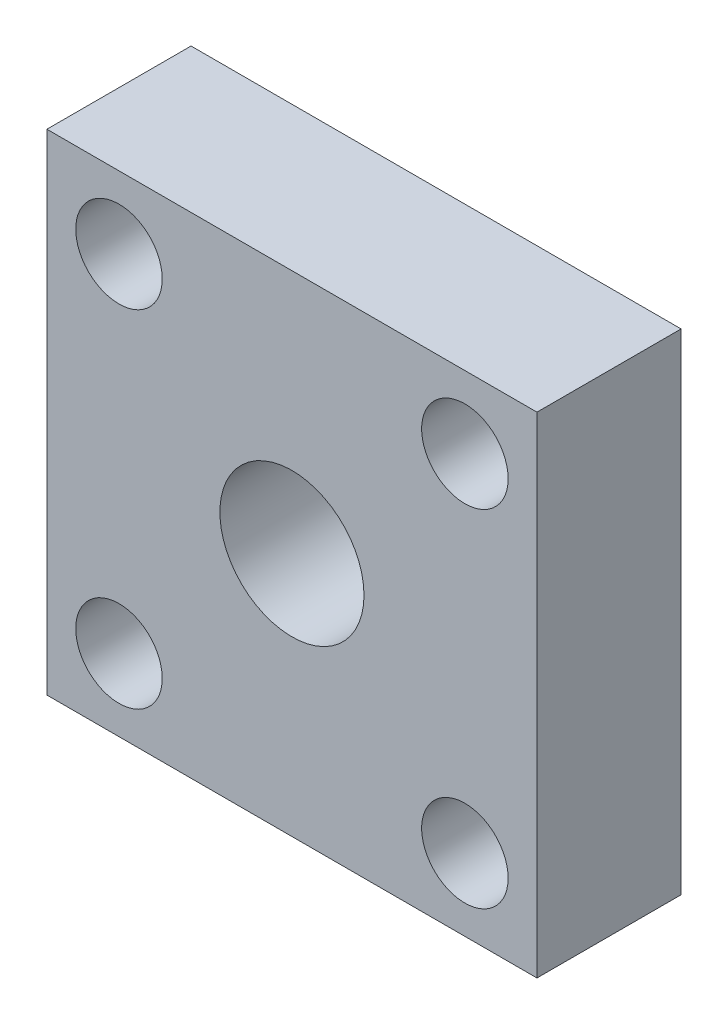
from build123d import *

# Parameters (mm, degrees)
SKETCH1_W            = 34
SKETCH1_H            = 34
SKETCH1_R            = 5
BOSS_EXTRUDE1_DEPTH  = 10
SKETCH2_R            = 3
CUT_EXTRUDE1_DEPTH   = 5
LPATTERN1_COUNT      = 2
LPATTERN1_PITCH      = 24
LPATTERN1_COUNT_DIR2 = 2
LPATTERN1_PITCH_DIR2 = 24


with BuildPart() as part:
    # Sketch1 → Boss-Extrude1 (new body)
    with BuildSketch(Plane.XY):
        with Locations((-1.444444444, -4.888888889)):
            Rectangle(SKETCH1_W, SKETCH1_H)
        with Locations((-1.444444444, -4.888888889)):
            Circle(SKETCH1_R, mode=Mode.SUBTRACT)
    extrude(amount=BOSS_EXTRUDE1_DEPTH)

    # Sketch2 → Cut-Extrude1 (cut)
    with BuildSketch(Plane.XY.offset(10)):
        with Locations((-13.444444444, 7.111111111)):
            Circle(SKETCH2_R)
    cut_extrude1 = extrude(amount=-CUT_EXTRUDE1_DEPTH, mode=Mode.SUBTRACT)

    # LPattern1: Cut-Extrude1 2 × 2
    with Locations(*[(i * LPATTERN1_PITCH, -j * LPATTERN1_PITCH_DIR2, 0) for i in range(LPATTERN1_COUNT) for j in range(LPATTERN1_COUNT_DIR2) if (i, j) != (0, 0)]):
        add(cut_extrude1, mode=Mode.SUBTRACT)


solid = part.part
